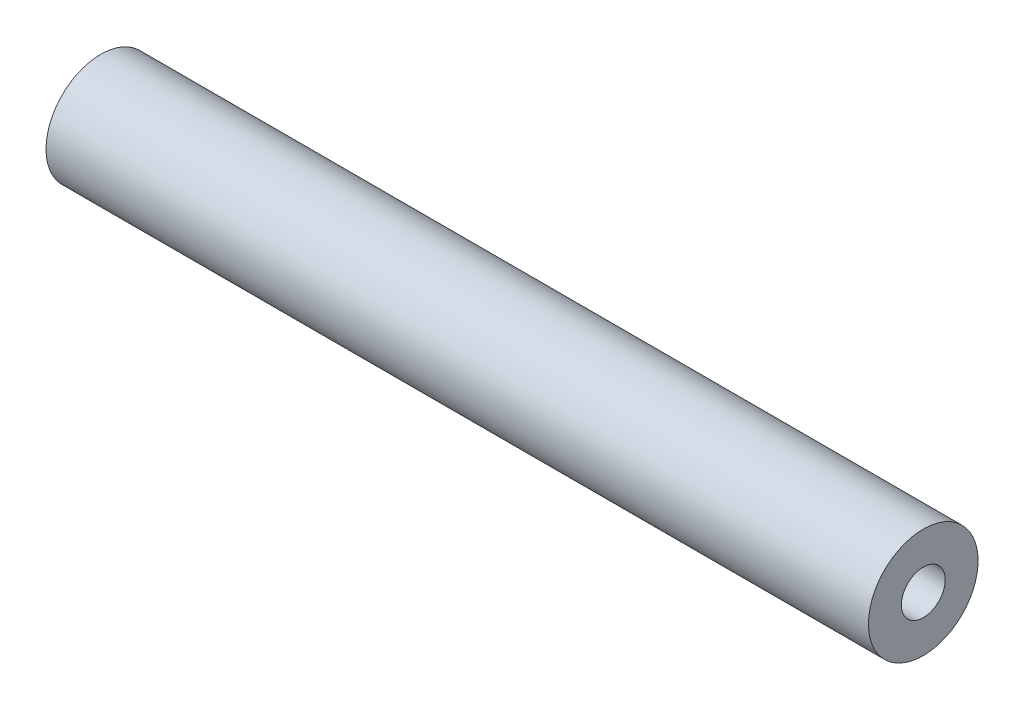
from build123d import *

# Parameters (mm, degrees)
SKETCH1_W = 19.05
SKETCH1_H = 0.762


with BuildPart() as part:
    # Sketch1 → Revolve1 (revolve)
    with BuildSketch(Plane(origin=(0, 0, 0), x_dir=(1, 0, 0), z_dir=(0, 1, 0))):
        with Locations((9.525, 0.889)):
            Rectangle(SKETCH1_W, SKETCH1_H)
    revolve(axis=Axis((0, 0, 0), (1, 0, 0)))


solid = part.part
